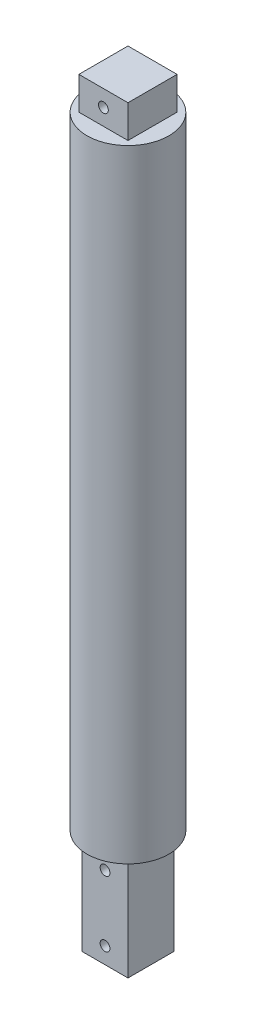
from build123d import *

# Parameters (mm, degrees)
SKETCH1_W           = 14
SKETCH1_H           = 32
SKETCH1_R           = 1.5
BOSS_EXTRUDE1_DEPTH = 7
SKETCH3_R           = 12.5
BOSS_EXTRUDE2_DEPTH = 200
SKETCH4_OUTSIDE_W   = 73.936
SKETCH4_OUTSIDE_H   = 73.936
SKETCH4_OUTSIDE_W_2 = 15
SKETCH4_OUTSIDE_H_2 = 15
CUT_EXTRUDE1_DEPTH  = 10
SKETCH5_R           = 1.5
CUT_EXTRUDE2_DEPTH  = 234.195733237


with BuildPart() as part:
    # Sketch1 → Boss-Extrude1 (new, symmetric)
    with BuildSketch(Plane.XY):
        with Locations((0, 16)):
            Rectangle(SKETCH1_W, SKETCH1_H)
        with Locations((0, 5)):
            Circle(SKETCH1_R, mode=Mode.SUBTRACT)
        with Locations((0, 25)):
            Circle(SKETCH1_R, mode=Mode.SUBTRACT)
    extrude(amount=BOSS_EXTRUDE1_DEPTH, both=True)

    # Sketch3 → Boss-Extrude2 (add)
    with BuildSketch(Plane(origin=(0, 32, 0), x_dir=(1, 0, 0), z_dir=(0, 1, 0))):
        Circle(SKETCH3_R)
    extrude(amount=BOSS_EXTRUDE2_DEPTH)

    # Sketch4 outside → Cut-Extrude1 (cut)
    with BuildSketch(Plane(origin=(0, 232, 0), x_dir=(1, 0, 0), z_dir=(0, 1, 0))):
        Rectangle(SKETCH4_OUTSIDE_W, SKETCH4_OUTSIDE_H)
        Rectangle(SKETCH4_OUTSIDE_W_2, SKETCH4_OUTSIDE_H_2, mode=Mode.SUBTRACT)
    extrude(amount=-CUT_EXTRUDE1_DEPTH, mode=Mode.SUBTRACT)

    # Sketch5 → Cut-Extrude2 (cut, through all)
    with BuildSketch(Plane.XY.offset(7.5)):
        with Locations((0, 227)):
            Circle(SKETCH5_R)
    extrude(amount=-CUT_EXTRUDE2_DEPTH, mode=Mode.SUBTRACT)


solid = part.part
